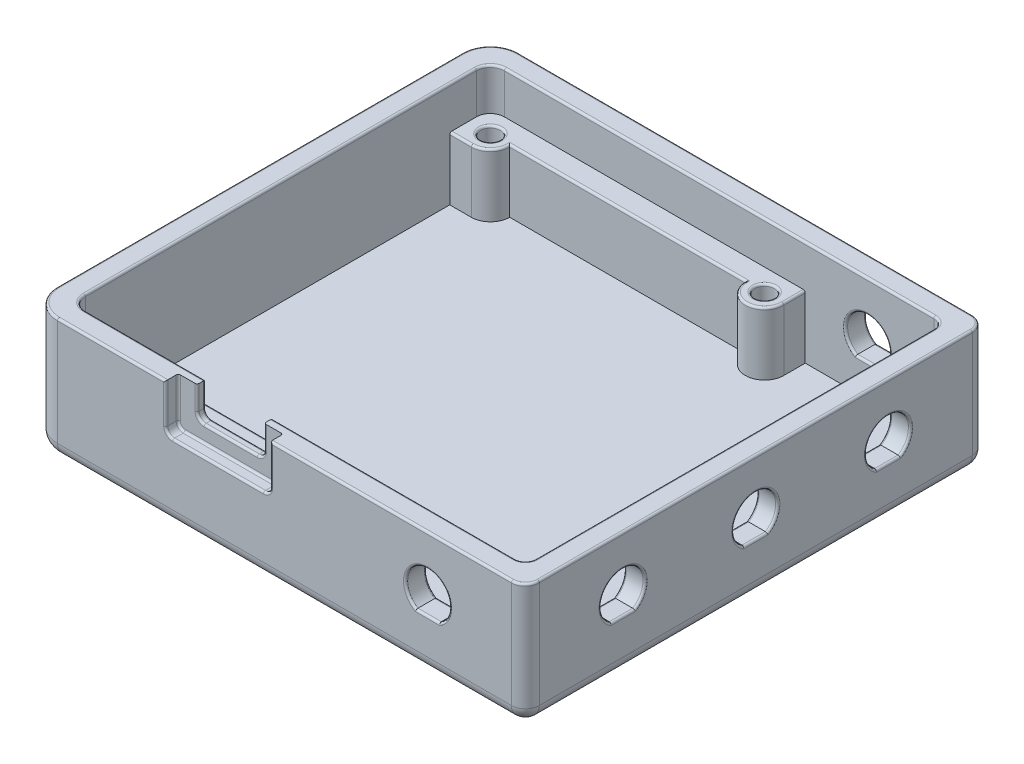
from build123d import *

# Parameters (mm, degrees)
SKETCH1_W           = 71
SKETCH1_H           = 66
SKETCH1_W_2         = 65
SKETCH1_H_2         = 60
BOSS_EXTRUDE1_DEPTH = 15
SKETCH4_W           = 71
SKETCH4_H           = 66
BOSS_EXTRUDE3_DEPTH = 2.5
SKETCH5_R           = 1.4
BOSS_EXTRUDE4_DEPTH = 9
FILLET1_R           = 2
FILLET2_R           = 4
FILLET3_R           = 2
SKETCH6_W           = 9.6
SKETCH6_H           = 8.232644003
CUT_EXTRUDE1_DEPTH  = 4.45
FILLET4_R           = 1
SKETCH7_W           = 15
SKETCH7_H           = 10
CUT_EXTRUDE2_DEPTH  = 1.8
FILLET5_R           = 1
CUT_EXTRUDE3_REACH  = 81.718
CUT_EXTRUDE4_DEPTH  = 77.428070759
FILLET6_R           = 0.3
FILLET7_R           = 1.5
FILLET8_R           = 0.3
FILLET9_R           = 0.3


with BuildPart() as part:
    # Sketch1 → Boss-Extrude1 (new body)
    with BuildSketch(Plane(origin=(0, 0, 0), x_dir=(1, 0, 0), z_dir=(0, 1, 0))):
        Rectangle(SKETCH1_W, SKETCH1_H)
        Rectangle(SKETCH1_W_2, SKETCH1_H_2, mode=Mode.SUBTRACT)
    extrude(amount=BOSS_EXTRUDE1_DEPTH)

    # Sketch4 → Boss-Extrude3 (add)
    with BuildSketch(Plane.XZ):
        Rectangle(SKETCH4_W, SKETCH4_H)
    extrude(amount=BOSS_EXTRUDE3_DEPTH)

    # Sketch5 → Boss-Extrude4 (add)
    # profile 1 of 2: a face of its own
    with BuildSketch(Plane(origin=(0, 0, 0), x_dir=(1, 0, 0), z_dir=(0, 1, 0))):
        with BuildLine():
            Line((-26.67, -26.925), (7.081, -26.925))
            ThreePointArc((7.081, -26.925), (9.831, -24.175), (12.581, -26.925))
            Line((12.581, -26.925), (12.581, -30))
            Line((12.581, -30), (-32.5, -30))
            Line((-32.5, -30), (-32.5, -24.175))
            Line((-32.5, -24.175), (-29.42, -24.175))
            ThreePointArc((-29.42, -24.175), (-27.475456352, -24.980456352), (-26.67, -26.925))
        make_face()
        with Locations((9.831, -26.925)):
            Circle(SKETCH5_R, mode=Mode.SUBTRACT)
        with Locations((-29.42, -26.925)):
            Circle(SKETCH5_R, mode=Mode.SUBTRACT)
    # profile 2 of 2: a face of its own
    with BuildSketch(Plane(origin=(0, 0, 0), x_dir=(1, 0, 0), z_dir=(0, 1, 0))):
        with BuildLine():
            Line((-26.67, 26.925), (7.081, 26.925))
            ThreePointArc((7.081, 26.925), (9.831, 24.175), (12.581, 26.925))
            Line((12.581, 26.925), (12.581, 30))
            Line((12.581, 30), (-32.5, 30))
            Line((-32.5, 30), (-32.5, 24.175))
            Line((-32.5, 24.175), (-29.42, 24.175))
            ThreePointArc((-29.42, 24.175), (-27.475456352, 24.980456352), (-26.67, 26.925))
        make_face()
        with Locations((-29.42, 26.925)):
            Circle(SKETCH5_R, mode=Mode.SUBTRACT)
        with Locations((9.831, 26.925)):
            Circle(SKETCH5_R, mode=Mode.SUBTRACT)
    extrude(amount=BOSS_EXTRUDE4_DEPTH)

    # Fillet1
    fillet1_edges = [part.edges().sort_by_distance(p)[0] for p in [
        (-32.5, 12, 30),
        (-32.5, 12, -30),
    ]]
    fillet(fillet1_edges, radius=FILLET1_R)

    # Fillet2
    fillet2_edges = [part.edges().sort_by_distance(p)[0] for p in [
        (-35.5, 6.25, -33),
        (-35.5, 6.25, 33),
    ]]
    fillet(fillet2_edges, radius=FILLET2_R)

    # Fillet3
    fillet3_edges = [part.edges().sort_by_distance(p)[0] for p in [
        (2, -2.5, 33),
        (-34.328427125, -2.5, 31.828427125),
        (-35.5, -2.5, 0),
        (-34.328427125, -2.5, -31.828427125),
        (35.5, 6.25, 33),
        (35.5, -2.5, 0),
        (35.5, 6.25, -33),
        (2, -2.5, -33),
    ]]
    fillet(fillet3_edges, radius=FILLET3_R)

    # Sketch6 → Cut-Extrude1 (cut)
    with BuildSketch(Plane(origin=(0, 15, 0), x_dir=(1, 0, 0), z_dir=(0, 1, 0))):
        with Locations((-8.5, -31.835603711)):
            Rectangle(SKETCH6_W, SKETCH6_H)
    extrude(amount=-CUT_EXTRUDE1_DEPTH, mode=Mode.SUBTRACT)

    # Fillet4
    fillet4_edges = [part.edges().sort_by_distance(p)[0] for p in [
        (-3.7, 10.55, 31.5),
        (-13.3, 10.55, 31.5),
    ]]
    fillet(fillet4_edges, radius=FILLET4_R)

    # Sketch7 → Cut-Extrude2 (cut)
    with BuildSketch(Plane.XY.offset(33)):
        with Locations((-8.5, 13.275)):
            Rectangle(SKETCH7_W, SKETCH7_H)
    extrude(amount=-CUT_EXTRUDE2_DEPTH, mode=Mode.SUBTRACT)

    # Fillet5
    fillet5_edges = [part.edges().sort_by_distance(p)[0] for p in [
        (-1, 8.275, 32.1),
        (-16, 8.275, 32.1),
    ]]
    fillet(fillet5_edges, radius=FILLET5_R)

    # Sketch8 → Cut-Extrude3 (cut, up to next)
    with BuildSketch(Plane(origin=(35.5, 0, 0), x_dir=(0, 0, -1), z_dir=(1, 0, 0)), mode=Mode.PRIVATE) as cut_extrude3_sk1:
        with BuildLine():
            Line((-20.671406593, 4.58), (-17.328593407, 4.58))
            ThreePointArc((-17.328593407, 4.58), (-19, 10.4), (-20.671406593, 4.58))
        make_face()
    cut_extrude3_tool1 = extrude(cut_extrude3_sk1.sketch, amount=-CUT_EXTRUDE3_REACH, mode=Mode.PRIVATE) & part.part
    # Sketch8 → Cut-Extrude3 (cut, up to next)
    with BuildSketch(Plane(origin=(35.5, 0, 0), x_dir=(0, 0, -1), z_dir=(1, 0, 0)), mode=Mode.PRIVATE) as cut_extrude3_sk2:
        with BuildLine():
            Line((-1.671406593, 4.58), (1.671406593, 4.58))
            ThreePointArc((1.671406593, 4.58), (0, 10.4), (-1.671406593, 4.58))
        make_face()
    cut_extrude3_tool2 = extrude(cut_extrude3_sk2.sketch, amount=-CUT_EXTRUDE3_REACH, mode=Mode.PRIVATE) & part.part
    # Sketch8 → Cut-Extrude3 (cut, up to next)
    with BuildSketch(Plane(origin=(35.5, 0, 0), x_dir=(0, 0, -1), z_dir=(1, 0, 0)), mode=Mode.PRIVATE) as cut_extrude3_sk3:
        with BuildLine():
            Line((17.328593407, 4.58), (20.671406593, 4.58))
            ThreePointArc((20.671406593, 4.58), (19, 10.4), (17.328593407, 4.58))
        make_face()
    cut_extrude3_tool3 = extrude(cut_extrude3_sk3.sketch, amount=-CUT_EXTRUDE3_REACH, mode=Mode.PRIVATE) & part.part
    add(cut_extrude3_tool1.solids().sort_by_distance((35.5, 7.353467, 19))[0], mode=Mode.SUBTRACT)
    add(cut_extrude3_tool2.solids().sort_by_distance((35.5, 7.353467, 0))[0], mode=Mode.SUBTRACT)
    add(cut_extrude3_tool3.solids().sort_by_distance((35.5, 7.353467, -19))[0], mode=Mode.SUBTRACT)

    # Sketch9 → Cut-Extrude4 (cut, through all)
    with BuildSketch(Plane.XY.offset(33)):
        with BuildLine():
            ThreePointArc((23.171406593, 4.58), (21.5, 10.4), (19.828593407, 4.58))
            Line((19.828593407, 4.58), (23.171406593, 4.58))
        make_face()
    extrude(amount=-CUT_EXTRUDE4_DEPTH, mode=Mode.SUBTRACT)

    # Fillet6
    fillet6_edges = [part.edges().sort_by_distance(p)[0] for p in [
        (-1, 12.1375, 31.2),
        (-1.292893219, 8.567893219, 31.2),
        (-8.5, 8.275, 31.2),
        (-15.707106781, 8.567893219, 31.2),
        (-3.7, 13.275, 31.2),
        (-3.992893219, 10.842893219, 31.2),
        (-8.5, 10.55, 31.2),
        (-13.3, 13.275, 31.2),
        (-1, 12.1375, 33),
        (-1.292893219, 8.567893219, 33),
        (-8.5, 8.275, 33),
        (-15.707106781, 8.567893219, 33),
        (16.25, 15, 33),
        (34.914213562, 15, 32.414213562),
        (35.5, 15, 0),
        (34.914213562, 15, -32.414213562),
        (1, 15, -33),
        (-34.328427125, 15, -31.828427125),
        (-35.5, 15, 0),
        (-34.328427125, 15, 31.828427125),
        (-16, 12.1375, 31.2),
        (-13.007106781, 10.842893219, 31.2),
        (-16, 12.1375, 33),
        (-23.75, 15, 33),
    ]]
    fillet(fillet6_edges, radius=FILLET6_R)

    # Fillet7
    fillet7_edges = [part.edges().sort_by_distance(p)[0] for p in [
        (32.5, 7.5, 30),
        (32.5, 7.5, -30),
    ]]
    fillet(fillet7_edges, radius=FILLET7_R)

    # Fillet8
    fillet8_edges = [part.edges().sort_by_distance(p)[0] for p in [
        (-13.3, 13.275, 30),
        (-13.007106781, 10.842893219, 30),
        (-8.5, 10.55, 30),
        (-3.992893219, 10.842893219, 30),
        (13.65, 15, 30),
        (32.060660172, 15, 29.560660172),
        (32.5, 15, 0),
        (32.060660172, 15, -29.560660172),
        (-21.9, 15, 30),
        (-31.914213562, 15, 29.414213562),
        (-32.5, 15, 0),
        (-31.914213562, 15, -29.414213562),
        (-3.7, 13.275, 30),
        (0.25, 15, -30),
    ]]
    fillet(fillet8_edges, radius=FILLET8_R)

    # Fillet9
    fillet9_edges = [part.edges().sort_by_distance(p)[0] for p in [
        (12.581, 9, 28.4625),
        (-27.475456352, 9, 24.980456352),
        (-30.96, 9, -24.175),
        (12.581, 9, -28.4625),
        (8.431, 9, -26.925),
        (-30.82, 9, -26.925),
        (-30.82, 9, 26.925),
        (8.431, 9, 26.925),
        (9.831, 9, 24.175),
        (-9.7945, 9, 26.925),
        (-30.96, 9, 24.175),
        (-27.475456352, 9, -24.980456352),
        (9.831, 9, -24.175),
        (-9.7945, 9, -26.925),
        (21.5, 4.58, -30),
        (21.5, 10.4, -30),
        (32.5, 4.58, -19),
        (32.5, 10.4, -19),
        (32.5, 4.58, 0),
        (32.5, 10.4, 0),
        (32.5, 4.58, 19),
        (32.5, 10.4, 19),
        (21.5, 4.58, 30),
        (21.5, 10.4, 30),
        (21.5, 4.58, 33),
        (21.5, 10.4, 33),
        (21.5, 4.58, -33),
        (21.5, 10.4, -33),
        (35.5, 4.58, 19),
        (35.5, 10.4, 19),
        (35.5, 4.58, 0),
        (35.5, 10.4, 0),
        (35.5, 10.4, -19),
        (35.5, 4.58, -19),
    ]]
    fillet(fillet9_edges, radius=FILLET9_R)


solid = part.part
